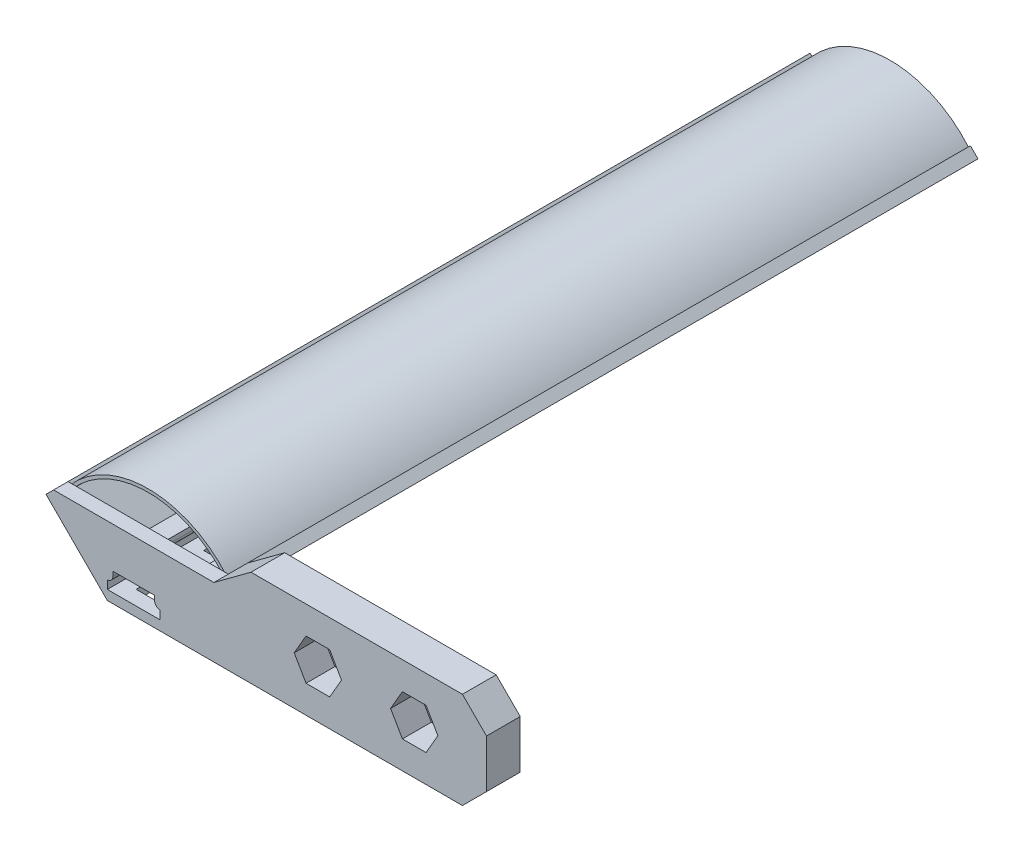
from build123d import *

# Parameters (mm, degrees)
BOSS_EXTRUDE1_DEPTH = 157
SKETCH2_W           = 5
SKETCH2_H           = 5
CUT_EXTRUDE1_DEPTH  = 157
SKETCH3_W           = 5
SKETCH3_H           = 5
CUT_EXTRUDE2_DEPTH  = 157
FILLET1_R           = 1.2
BOSS_EXTRUDE2_DEPTH = 3
BOSS_EXTRUDE3_DEPTH = 7
SKETCH6_R           = 2.75
CUT_EXTRUDE3_DEPTH  = 175.380916674
CUT_EXTRUDE4_DEPTH  = 6
BOSS_EXTRUDE4_DEPTH = 154


with BuildPart() as part:
    # Sketch1 → Boss-Extrude1 (new body)
    with BuildSketch(Plane.XY):
        Polygon((5.48, 0), (18.21, 12.73), (16.635, 14.305), (16.210735931, 13.880735931), (17.059264069, 13.032207794), (16.599644661, 12.572588386), (15.751116524, 13.421116524), (8.18, 5.85), (4.33, 5.85), (4.33, 3.73), (5.48, 3.73), (5.48, 2), (-5.48, 2), (-5.48, 3.73), (-4.33, 3.73), (-4.33, 5.85), (-8.18, 5.85), (-15.751116524, 13.421116524), (-16.599644661, 12.572588386), (-17.059264069, 13.032207794), (-16.210735931, 13.880735931), (-16.635, 14.305), (-18.21, 12.73), (-5.48, 0), align=None)
    extrude(amount=BOSS_EXTRUDE1_DEPTH)

    # Sketch2 → Cut-Extrude1 (cut)
    with BuildSketch(Plane(origin=(0, 2, 0), x_dir=(1, 0, 0), z_dir=(0, 1, 0))):
        with Locations((0, -4.5)):
            Rectangle(SKETCH2_W, SKETCH2_H)
        with Locations((0, -151.5)):
            Rectangle(SKETCH2_W, SKETCH2_H)
    extrude(amount=-CUT_EXTRUDE1_DEPTH, mode=Mode.SUBTRACT)

    # Sketch3 → Cut-Extrude2 (cut)
    with BuildSketch(Plane(origin=(0, 2, 0), x_dir=(1, 0, 0), z_dir=(0, 1, 0))):
        with Locations((0, -144.5)):
            Rectangle(SKETCH3_W, SKETCH3_H)
        with Locations((0, -137.5)):
            Rectangle(SKETCH3_W, SKETCH3_H)
        with Locations((0, -130.5)):
            Rectangle(SKETCH3_W, SKETCH3_H)
        with Locations((0, -88.5)):
            Rectangle(SKETCH3_W, SKETCH3_H)
        with Locations((0, -81.5)):
            Rectangle(SKETCH3_W, SKETCH3_H)
        with Locations((0, -95.5)):
            Rectangle(SKETCH3_W, SKETCH3_H)
        with Locations((0, -102.5)):
            Rectangle(SKETCH3_W, SKETCH3_H)
        with Locations((0, -109.5)):
            Rectangle(SKETCH3_W, SKETCH3_H)
        with Locations((0, -116.5)):
            Rectangle(SKETCH3_W, SKETCH3_H)
        with Locations((0, -123.5)):
            Rectangle(SKETCH3_W, SKETCH3_H)
        with Locations((0, -33.5)):
            Rectangle(SKETCH3_W, SKETCH3_H)
        with Locations((0, -40.5)):
            Rectangle(SKETCH3_W, SKETCH3_H)
        with Locations((0, -47.5)):
            Rectangle(SKETCH3_W, SKETCH3_H)
        with Locations((0, -54.5)):
            Rectangle(SKETCH3_W, SKETCH3_H)
        with Locations((0, -61.5)):
            Rectangle(SKETCH3_W, SKETCH3_H)
        with Locations((0, -75.5)):
            Rectangle(SKETCH3_W, SKETCH3_H)
        with Locations((0, -68.5)):
            Rectangle(SKETCH3_W, SKETCH3_H)
        with Locations((0, -26.5)):
            Rectangle(SKETCH3_W, SKETCH3_H)
        with Locations((0, -19.5)):
            Rectangle(SKETCH3_W, SKETCH3_H)
        with Locations((0, -12.5)):
            Rectangle(SKETCH3_W, SKETCH3_H)
    extrude(amount=-CUT_EXTRUDE2_DEPTH, mode=Mode.SUBTRACT)

    # Fillet1
    # the kernel refuses this fillet: 1.2 mm, written as the material it takes off along each edge
    with BuildSketch(Plane(origin=(4.33, 3.73, -2.997394702), x_dir=(0, 1, 0), z_dir=(0, 0, 1))) as fillet1_piece_1:
        with BuildLine():
            CenterArc((1.198957881, -1.2), FILLET1_R, 90, 87.611984537)
            Line((0, -1.15), (-0.023979158, -1.149))
            ThreePointArc((-0.023979158, -1.149), (-0.024, -0.575), (-0.024, 0))
            Line((-0.024, 0), (0, 0.024))
            Line((0, 0.024), (1.198957881, 0.024))
            Line((1.198957881, 0.024), (1.198957881, 0))
        make_face()
    extrude(amount=162.994789404, mode=Mode.SUBTRACT)
    with BuildSketch(Plane(origin=(-4.33, 3.73, -2.997394702), x_dir=(-1, 0, 0), z_dir=(0, 0, 1))) as fillet1_piece_2:
        with BuildLine():
            CenterArc((1.2, -1.198957881), FILLET1_R, 92.388015463, 87.611984537)
            Line((0, -1.198957881), (-0.024, -1.198957881))
            Line((-0.024, -1.198957881), (-0.024, 0))
            Line((-0.024, 0), (0, 0.024))
            ThreePointArc((0, 0.024), (0.575, 0.024), (1.149, 0.023979158))
            Line((1.149, 0.023979158), (1.15, 0))
        make_face()
    extrude(amount=162.994789404, mode=Mode.SUBTRACT)

    # Sketch4 → Boss-Extrude2 (add)
    with BuildSketch(Plane.XY.offset(157)):
        Polygon((-16.635, 14.305), (16.635, 14.305), (18.21, 12.73), (5.48, 0), (-5.48, 0), (-18.21, 12.73), align=None)
        with BuildLine():
            Line((-5.48, 5.85), (5.48, 5.85))
            ThreePointArc((5.48, 5.85), (7.405, 3.925), (5.48, 2))
            Line((5.48, 2), (-5.48, 2))
            ThreePointArc((-5.48, 2), (-7.405, 3.925), (-5.48, 5.85))
        make_face(mode=Mode.SUBTRACT)
    extrude(amount=-BOSS_EXTRUDE2_DEPTH)

    # Sketch5 → Boss-Extrude3 (add)
    with BuildSketch(Plane.XY.offset(157)):
        with BuildLine():
            Line((23.21, 0), (68.21, 0))
            Line((68.21, 0), (73.21, 5))
            Line((73.21, 5), (73.21, 15))
            Line((73.21, 15), (68.21, 20))
            Line((68.21, 20), (24.333330784, 20))
            Line((24.333330784, 20), (16.635, 14.305))
            ThreePointArc((16.635, 14.305), (17.363929946, 13.458929946), (18.21, 12.73))
            Line((18.21, 12.73), (5.48, 0))
            Line((5.48, 0), (23.21, 0))
        make_face()
    extrude(amount=-BOSS_EXTRUDE3_DEPTH)

    # Sketch6 → Cut-Extrude3 (cut, through all)
    with BuildSketch(Plane.XY.offset(157)):
        with Locations((38.21, 10)):
            Circle(SKETCH6_R)
        with Locations((58.21, 10)):
            Circle(SKETCH6_R)
    extrude(amount=-CUT_EXTRUDE3_DEPTH, mode=Mode.SUBTRACT)

    # Sketch7 → Cut-Extrude4 (cut)
    with BuildSketch(Plane.XY.offset(157)):
        Polygon((43.117477288, 10), (40.663738644, 14.25), (35.756261356, 14.25), (33.302522712, 10), (35.756261356, 5.75), (40.663738644, 5.75), align=None)
        Polygon((63.117477288, 10), (60.663738644, 14.25), (55.756261356, 14.25), (53.302522712, 10), (55.756261356, 5.75), (60.663738644, 5.75), align=None)
    extrude(amount=-CUT_EXTRUDE4_DEPTH, mode=Mode.SUBTRACT)


with BuildPart() as body_2:
    # Sketch8 → Boss-Extrude4 (new body)
    with BuildSketch(Plane(origin=(0, 0, 0), x_dir=(-1, 0, 0), z_dir=(0, 0, -1))):
        with BuildLine():
            Line((15.751116524, 13.421116524), (16.210735931, 13.880735931))
            ThreePointArc((16.210735931, 13.880735931), (0, 21.341574202), (-16.210735931, 13.880735931))
            Line((-16.210735931, 13.880735931), (-15.751116524, 13.421116524))
            ThreePointArc((-15.751116524, 13.421116524), (0, 20.69357486), (15.751116524, 13.421116524))
        make_face()
    extrude(amount=-BOSS_EXTRUDE4_DEPTH)


solid = Compound([part.part, body_2.part])
